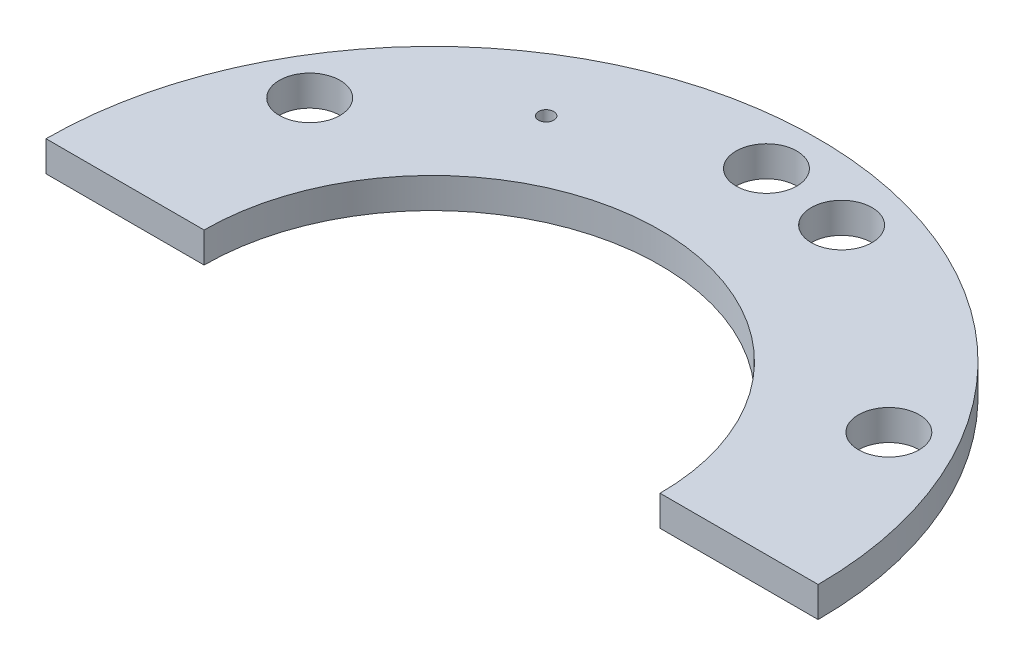
from build123d import *

# Parameters (mm, degrees)
SKETCH1_R               = 12.7
BOSS_EXTRUDE1_DEPTH     = 1
CUT_EXTRUDE1_DEPTH      = 18.98832955
CUT_EXTRUDE1_DEPTH_BACK = 18.98832955
SKETCH19_R              = 1
CUT_EXTRUDE2_DEPTH      = 18.98832955
CUT_EXTRUDE2_DEPTH_BACK = 18.98832955
SKETCH20_R              = 7.5
SKETCH21_W              = 65.874202484
SKETCH21_H              = 51.979273979
CUT_EXTRUDE3_DEPTH      = 18.98832955
CUT_EXTRUDE4_DEPTH      = 18.98832955
CUT_EXTRUDE4_DEPTH_BACK = 18.98832955
SKETCH22_R              = 0.25
CUT_EXTRUDE5_DEPTH      = 18.98832955
CUT_EXTRUDE5_DEPTH_BACK = 18.98832955
SKETCH23_R              = 1


with BuildPart() as part:
    # Sketch1 → Boss-Extrude1 (new body)
    with BuildSketch(Plane(origin=(0, 0, 0), x_dir=(1, 0, 0), z_dir=(0, 1, 0))):
        Circle(SKETCH1_R)
    extrude(amount=BOSS_EXTRUDE1_DEPTH)

    # Sketch19 → Cut-Extrude1 (cut, two sides: drawn at the far end of the back side and taken through both)
    with BuildSketch(Plane(origin=(0, 1, 0), x_dir=(1, 0, 0), z_dir=(0, 1, 0)).offset(-CUT_EXTRUDE1_DEPTH_BACK)):
        with Locations((0, 11)):
            Circle(SKETCH19_R)
        with Locations((9.526279442, 5.5)):
            Circle(SKETCH19_R)
        with Locations((9.526279442, -5.5)):
            Circle(SKETCH19_R)
        with Locations((0, -11)):
            Circle(SKETCH19_R)
        with Locations((-9.526279442, -5.5)):
            Circle(SKETCH19_R)
        with Locations((-9.526279442, 5.5)):
            Circle(SKETCH19_R)
    extrude(amount=CUT_EXTRUDE1_DEPTH + CUT_EXTRUDE1_DEPTH_BACK, mode=Mode.SUBTRACT)

    # Sketch20 → Cut-Extrude2 (cut, two sides: drawn at the far end of the back side and taken through both)
    with BuildSketch(Plane(origin=(0, 1, 0), x_dir=(1, 0, 0), z_dir=(0, 1, 0)).offset(-CUT_EXTRUDE2_DEPTH_BACK)):
        Circle(SKETCH20_R)
    extrude(amount=CUT_EXTRUDE2_DEPTH + CUT_EXTRUDE2_DEPTH_BACK, mode=Mode.SUBTRACT)

    # Sketch21 → Cut-Extrude3 (cut, through all)
    with BuildSketch(Plane.XY):
        with Locations((-3.816154381, 6.321647006)):
            Rectangle(SKETCH21_W, SKETCH21_H)
    extrude(amount=CUT_EXTRUDE3_DEPTH, mode=Mode.SUBTRACT)

    # Sketch22 → Cut-Extrude4 (cut, two sides: drawn at the far end of the back side and taken through both)
    with BuildSketch(Plane(origin=(0, 1, 0), x_dir=(1, 0, 0), z_dir=(0, 1, 0)).offset(-CUT_EXTRUDE4_DEPTH_BACK)):
        with Locations((-5.125, 8.876760389)):
            Circle(SKETCH22_R)
    extrude(amount=CUT_EXTRUDE4_DEPTH + CUT_EXTRUDE4_DEPTH_BACK, mode=Mode.SUBTRACT)

    # Sketch23 → Cut-Extrude5 (cut, two sides: drawn at the far end of the back side and taken through both)
    with BuildSketch(Plane(origin=(0, 1, 0), x_dir=(1, 0, 0), z_dir=(0, 1, 0)).offset(-CUT_EXTRUDE5_DEPTH_BACK)):
        with Locations((2.847009496, 10.625184089)):
            Circle(SKETCH23_R)
    extrude(amount=CUT_EXTRUDE5_DEPTH + CUT_EXTRUDE5_DEPTH_BACK, mode=Mode.SUBTRACT)


solid = part.part
